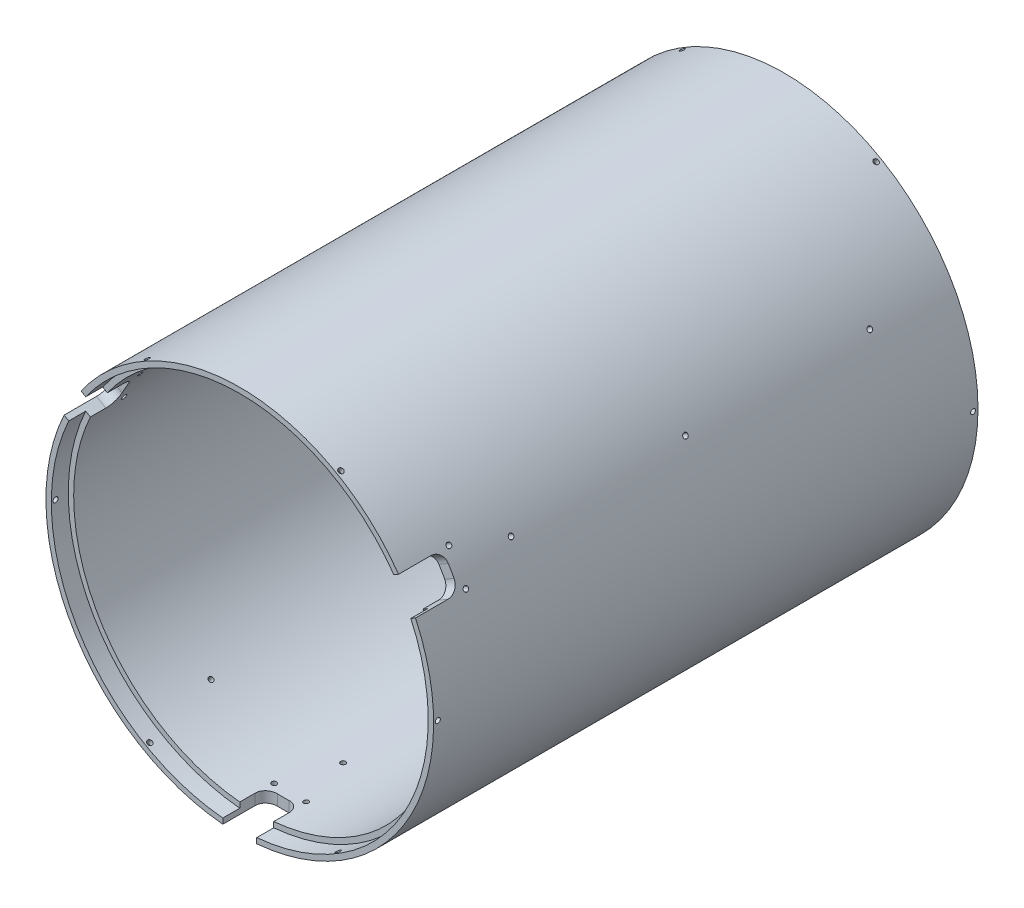
from build123d import *

# Parameters (mm, degrees)
SKETCH1_R                     = 114.3
SKETCH1_R_2                   = 107.95
BOSS_EXTRUDE1_DEPTH           = 350.9948
SKETCH2_R                     = 1.4732
CUT_EXTRUDE1_DEPTH            = 435.188668239
CIRPATTERN1_COUNT             = 3
SKETCH4_R                     = 111.125
SKETCH4_R_2                   = 107.95
CUT_EXTRUDE3_DEPTH            = 10.39855
CUT_EXTRUDE2_START            = -39.999999916
SKETCH3_R                     = 111.125
SKETCH3_R_2                   = 107.95
CUT_EXTRUDE2_DEPTH            = 39.999999916
SKETCH6_R                     = 1.4732
F_1ST_SPIDER_MOUNT_HOLE_DEPTH = 10
SKETCH7_R                     = 1.4732
F_2ND_SPIDER_MOUNT_HOLE_DEPTH = 10
CIRPATTERN3_COUNT             = 3
CUT_EXTRUDE7_DEPTH            = 387.42765137
CUT_EXTRUDE7_DEPTH_BACK       = 387.42765137
SKETCH9_W                     = 30
SKETCH9_H                     = 228.6
SKETCH13_R                    = 1.4351
INSTRUMENT_STAND_HOLES_DEPTH  = 10
CUT_EXTRUDE10_DEPTH           = 10
CIRPATTERN4_COUNT             = 3
SKETCH19_R                    = 1.473
CUT_EXTRUDE11_DEPTH           = 10
CIRPATTERN5_COUNT             = 3


with BuildPart() as part:
    # Sketch1 → Boss-Extrude1 (new body)
    with BuildSketch(Plane.XY):
        Circle(SKETCH1_R)
        Circle(SKETCH1_R_2, mode=Mode.SUBTRACT)
    extrude(amount=BOSS_EXTRUDE1_DEPTH)

    # Sketch2 → Cut-Extrude1 (cut, through all)
    with BuildSketch(Plane.ZY.offset(114.3)):
        with Locations((2.89922, 0)):
            Circle(SKETCH2_R)
        with Locations((340.9948, 0)):
            Circle(SKETCH2_R)
        with Locations((318.4948, 0)):
            Circle(SKETCH2_R)
    cut_extrude1 = extrude(amount=-CUT_EXTRUDE1_DEPTH, mode=Mode.SUBTRACT)

    # CirPattern1: Cut-Extrude1 ×3 about axis
    cirpattern1_axis = Axis((0, 0, 350.9948), (0, 0, -1))
    for i in range(1, CIRPATTERN1_COUNT):
        add(cut_extrude1.rotate(cirpattern1_axis, i * 360 / CIRPATTERN1_COUNT), mode=Mode.SUBTRACT)

    # Sketch4 → Cut-Extrude3 (cut)
    with BuildSketch(Plane(origin=(0, 0, 0), x_dir=(-1, 0, 0), z_dir=(0, 0, -1))):
        Circle(SKETCH4_R)
        Circle(SKETCH4_R_2, mode=Mode.SUBTRACT)
    extrude(amount=-CUT_EXTRUDE3_DEPTH, mode=Mode.SUBTRACT)

    # Sketch3 → Cut-Extrude2 (cut)
    with BuildSketch(Plane.XY.offset(350.9948).offset(CUT_EXTRUDE2_START)):
        Circle(SKETCH3_R)
        Circle(SKETCH3_R_2, mode=Mode.SUBTRACT)
    extrude(amount=CUT_EXTRUDE2_DEPTH, mode=Mode.SUBTRACT)

    # Sketch6 → 1st spider mount hole (cut)
    with BuildSketch(Plane(origin=(-93.629078662, 65.559786675, 0), x_dir=(0, 0, 1), z_dir=(-0.819152044288991, 0.5735764363510473, 0))):
        with Locations((291.2923, 0)):
            Circle(SKETCH6_R)
    f_1st_spider_mount_hole = extrude(amount=-F_1ST_SPIDER_MOUNT_HOLE_DEPTH, mode=Mode.SUBTRACT)

    # Sketch7 → 2nd spider mount hole (cut)
    with BuildSketch(Plane(origin=(-103.590980058, 48.305267317, 0), x_dir=(0, 0, 1), z_dir=(-0.9063077870366496, 0.4226182617407003, 0))):
        with Locations((291.2923, 0)):
            Circle(SKETCH7_R)
    f_2nd_spider_mount_hole = extrude(amount=-F_2ND_SPIDER_MOUNT_HOLE_DEPTH, mode=Mode.SUBTRACT)

    # CirPattern3: 1st spider mount hole, 2nd spider mount hole ×3 about axis
    cirpattern3_axis = Axis((0, 0, 350.9948), (0, 0, -1))
    add([f_1st_spider_mount_hole.rotate(cirpattern3_axis, i * 360 / CIRPATTERN3_COUNT) for i in range(1, CIRPATTERN3_COUNT)], mode=Mode.SUBTRACT)
    add([f_2nd_spider_mount_hole.rotate(cirpattern3_axis, i * 360 / CIRPATTERN3_COUNT) for i in range(1, CIRPATTERN3_COUNT)], mode=Mode.SUBTRACT)

    # Sketch9 → Cut-Extrude7 (cut, two sides: drawn at the far end of the back side and taken through both)
    with BuildSketch(Plane(origin=(0, 0, 0), x_dir=(0, 0, -1), z_dir=(1, 0, 0)).offset(-CUT_EXTRUDE7_DEPTH_BACK)):
        with Locations((-335.9948, 0)):
            Rectangle(SKETCH9_W, SKETCH9_H)
    extrude(amount=CUT_EXTRUDE7_DEPTH + CUT_EXTRUDE7_DEPTH_BACK, mode=Mode.SUBTRACT)

    # Sketch13 → Instrument Stand Holes (cut)
    with BuildSketch(Plane(origin=(65.559786675, -93.629078662, 0), x_dir=(0, 0, -1), z_dir=(0.5735764363510474, -0.8191520442889909, 0))):
        with Locations((-275.9948, 0)):
            Circle(SKETCH13_R)
        with Locations((-20, 0)):
            Circle(SKETCH13_R)
    instrument_stand_holes = extrude(amount=-INSTRUMENT_STAND_HOLES_DEPTH, mode=Mode.SUBTRACT)

    # Mirror1: Instrument Stand Holes across plane
    add(instrument_stand_holes.mirror(Plane(origin=(0, 0, 0), x_dir=(0, 0, 1), z_dir=(1, 0, 0))), mode=Mode.SUBTRACT)

    # Sketch18 → Cut-Extrude10 (cut)
    with BuildSketch(Plane(origin=(-98.986703653, 57.15, 0), x_dir=(0, 0, 1), z_dir=(-0.866025403784438, 0.500000000000001, 0))):
        with BuildLine():
            Line((320.9948, -10), (320.9948, 10))
            Line((320.9948, 10), (301.8958, 10))
            ThreePointArc((301.8958, 10), (297.226066817, 8.065733183), (295.2918, 3.396))
            Line((295.2918, 3.396), (295.2918, -3.396))
            ThreePointArc((295.2918, -3.396), (297.226066817, -8.065733183), (301.8958, -10))
            Line((301.8958, -10), (320.9948, -10))
        make_face()
    cut_extrude10 = extrude(amount=-CUT_EXTRUDE10_DEPTH, mode=Mode.SUBTRACT)

    # CirPattern4: Cut-Extrude10 ×3 about axis
    cirpattern4_axis = Axis((0, 0, 350.9948), (0, 0, -1))
    for i in range(1, CIRPATTERN4_COUNT):
        add(cut_extrude10.rotate(cirpattern4_axis, i * 360 / CIRPATTERN4_COUNT), mode=Mode.SUBTRACT)

    # Sketch19 → Cut-Extrude11 (cut)
    with BuildSketch(Plane(origin=(-98.986703653, 57.15, 0), x_dir=(0, 0, 1), z_dir=(-0.866025403784438, 0.500000000000001, 0))):
        with Locations((48.4933, 0)):
            Circle(SKETCH19_R)
        with Locations((157.1863, 0)):
            Circle(SKETCH19_R)
        with Locations((260.0263, 0)):
            Circle(SKETCH19_R)
    cut_extrude11 = extrude(amount=-CUT_EXTRUDE11_DEPTH, mode=Mode.SUBTRACT)

    # CirPattern5: Cut-Extrude11 ×3 about axis
    cirpattern5_axis = Axis((0, 0, 350.9948), (0, 0, -1))
    for i in range(1, CIRPATTERN5_COUNT):
        add(cut_extrude11.rotate(cirpattern5_axis, i * 360 / CIRPATTERN5_COUNT), mode=Mode.SUBTRACT)


solid = part.part
